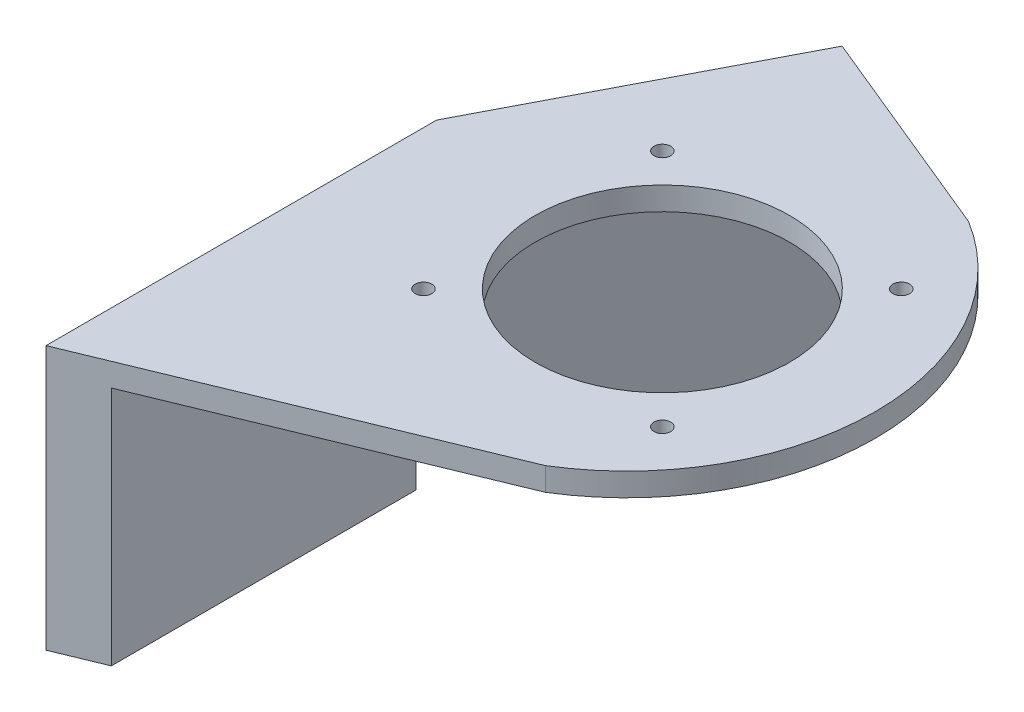
from build123d import *

# Parameters (mm, degrees)
SKETCH2_R           = 13.75
SKETCH2_R_2         = 0.9
BOSS_EXTRUDE1_DEPTH = 2.5
BOSS_EXTRUDE2_DEPTH = 26
SKETCH5_W           = 7.2
SKETCH5_H           = 21
BOSS_EXTRUDE5_DEPTH = 5


with BuildPart() as part:
    # Sketch2 → Boss-Extrude1 (new body)
    with BuildSketch(Plane(origin=(0, 0, 0), x_dir=(1, 0, 0), z_dir=(0, 1, 0))):
        with BuildLine():
            Line((104.5, -77.2), (142.702591635, -61.456260882))
            ThreePointArc((142.702591635, -61.456260882), (155.480653983, -38.6), (142.702591635, -15.743739118))
            Line((142.702591635, -15.743739118), (119.48341621, -6.174842748))
            Line((119.48341621, -6.174842748), (104.5, -35))
            Line((104.5, -35), (104.5, -77.2))
        make_face()
        with Locations((132.490326991, -38.6)):
            Circle(SKETCH2_R, mode=Mode.SUBTRACT)
        with Locations((145.395025748, -25.695301243)):
            Circle(SKETCH2_R_2, mode=Mode.SUBTRACT)
        with Locations((119.585628235, -51.504698757)):
            Circle(SKETCH2_R_2, mode=Mode.SUBTRACT)
        with Locations((119.585628235, -25.695301243)):
            Circle(SKETCH2_R_2, mode=Mode.SUBTRACT)
        with Locations((145.395025748, -51.504698757)):
            Circle(SKETCH2_R_2, mode=Mode.SUBTRACT)
    extrude(amount=BOSS_EXTRUDE1_DEPTH)

    # Sketch3 → Boss-Extrude2 (add)
    with BuildSketch(Plane.XZ):
        Polygon((104.5, 42.2), (109.5, 42.2), (109.5, 75.139440959), (104.5, 77.2), align=None)
        Polygon((109.5, 35), (104.5, 35), (119.48341621, 6.174842748), (123.601295817, 7.871869559), align=None)
    extrude(amount=BOSS_EXTRUDE2_DEPTH)

    # Sketch5 → Boss-Extrude5 (add)
    with BuildSketch(Plane.ZY.offset(-104.5)):
        with Locations((38.6, -10.5)):
            Rectangle(SKETCH5_W, SKETCH5_H)
    extrude(amount=-BOSS_EXTRUDE5_DEPTH)


solid = part.part
